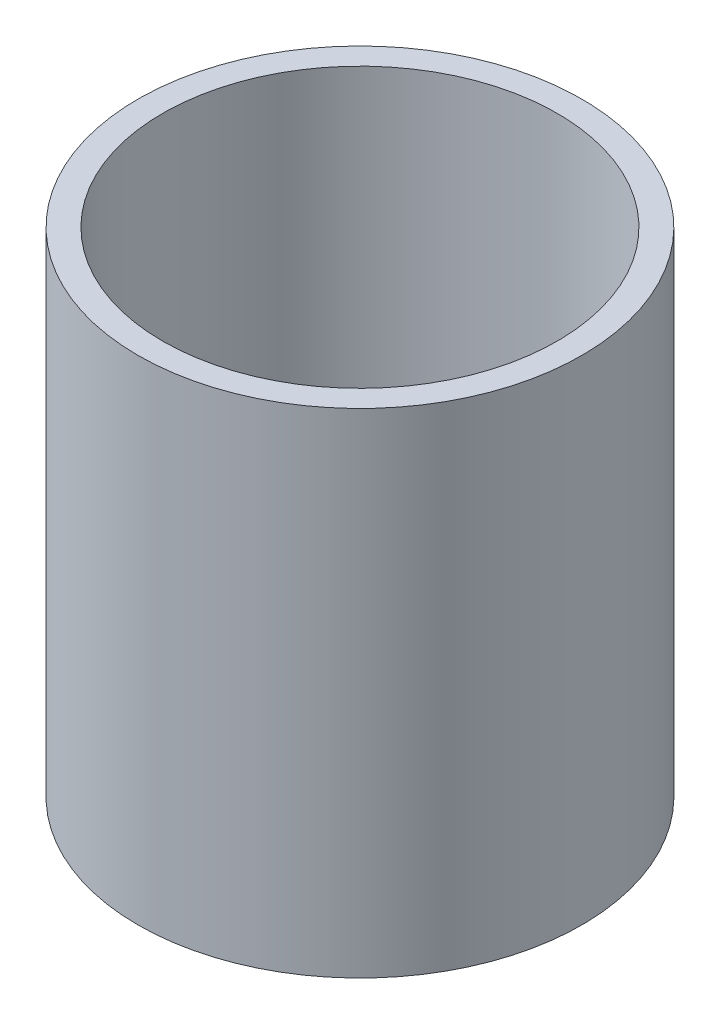
from build123d import *

# Parameters (mm, degrees)
SKETCH1_R           = 57.15
SKETCH1_R_2         = 50.8
BOSS_EXTRUDE1_DEPTH = 127


with BuildPart() as part:
    # Sketch1 → Boss-Extrude1 (new body)
    with BuildSketch(Plane(origin=(0, 0, 0), x_dir=(1, 0, 0), z_dir=(0, 1, 0))):
        Circle(SKETCH1_R)
        Circle(SKETCH1_R_2, mode=Mode.SUBTRACT)
    extrude(amount=BOSS_EXTRUDE1_DEPTH)


solid = part.part
